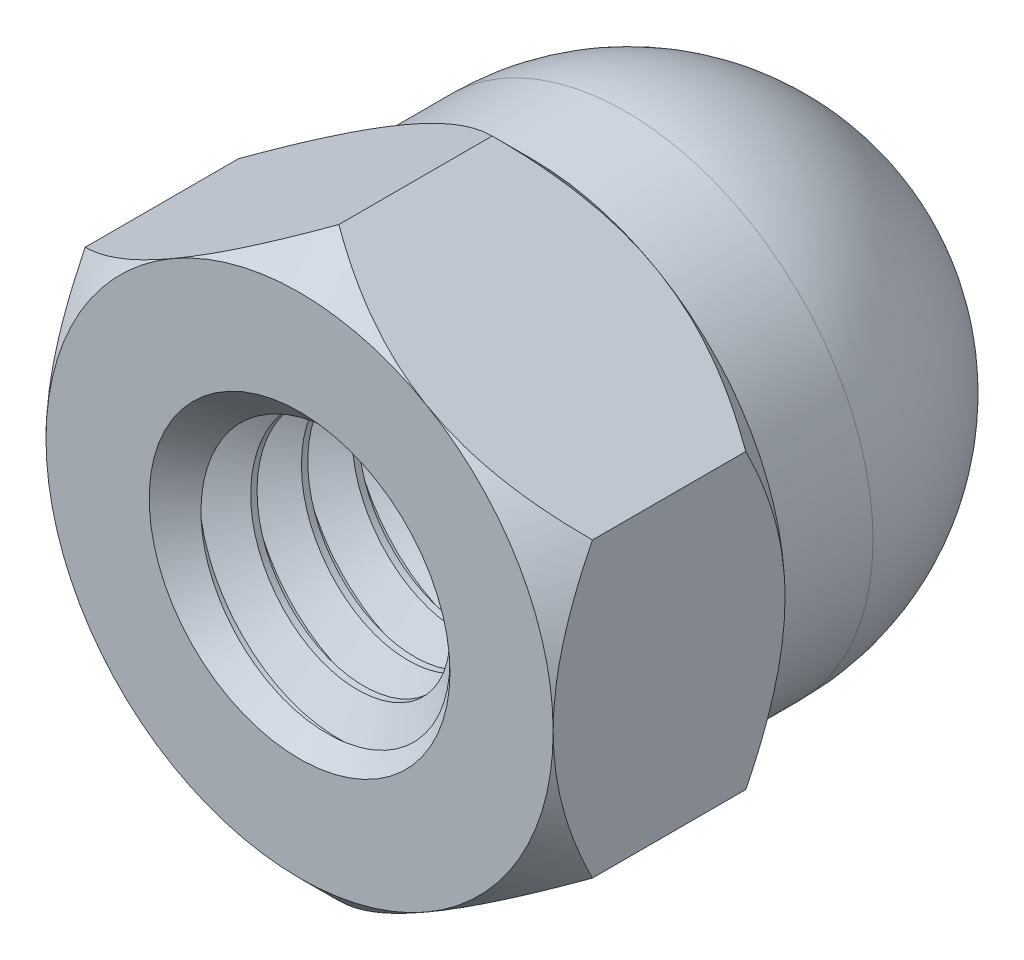
from build123d import *

# Parameters (mm, degrees)
BOSS_EXTRUDE2_DEPTH          = 3.2
SKETCH8_OUTSIDE_W            = 25.694
SKETCH8_OUTSIDE_H            = 26.776
SKETCH8_OUTSIDE_R            = 3.5
CUT_EXTRUDE3_DEPTH           = 7.23083729
CUT_EXTRUDE3_DRAFT           = -45
SKETCH9_OUTSIDE_W            = 25.694
SKETCH9_OUTSIDE_H            = 26.776
SKETCH9_OUTSIDE_R            = 3.5
CUT_EXTRUDE4_DEPTH           = 7.23083729
CUT_EXTRUDE4_DRAFT           = 45
SWEEP1_PITCH                 = 0.7
SKETCH15_R                   = 2.075777223
CUT_EXTRUDE5_OTHER_WAY_DEPTH = 10.622023469
CUT_EXTRUDE5_OTHER_WAY_TAPER = -45


with BuildPart() as part:
    # Sketch7 → Boss-Extrude2 (new body)
    with BuildSketch(Plane.XY.offset(4)):
        Polygon((0, 4.041451884), (-3.5, 2.020725942), (-3.5, -2.020725942), (0, -4.041451884), (3.5, -2.020725942), (3.5, 2.020725942), align=None)
    extrude(amount=-BOSS_EXTRUDE2_DEPTH)


with BuildPart() as cut_extrude3_tool:
    # Sketch8 outside → Cut-Extrude3 (with draft: the straight prism first)
    with BuildSketch(Plane.XY.offset(4)):
        Rectangle(SKETCH8_OUTSIDE_W, SKETCH8_OUTSIDE_H)
        Circle(SKETCH8_OUTSIDE_R, mode=Mode.SUBTRACT)
    extrude(amount=-CUT_EXTRUDE3_DEPTH)
    # Cut-Extrude3: the draft: its side faces are tilted about the plane it starts from
    cut_extrude3_sides = [cut_extrude3_tool.faces().sort_by_distance(p)[0] for p in [
        (0, -13.388, 0.384581355),
        (12.847, 0, 0.384581355),
        (0, 13.388, 0.384581355),
        (-12.847, 0, 0.384581355),
        (-3.5, 0, 0.384581355),
    ]]
    draft(cut_extrude3_sides, Plane.XY.offset(4), CUT_EXTRUDE3_DRAFT)


with BuildPart() as part_1:
    add(part.part)

    # Cut-Extrude3: cut by cut_extrude3_tool
    add(cut_extrude3_tool.part, mode=Mode.SUBTRACT)


with BuildPart() as cut_extrude4_tool:
    # Sketch9 outside → Cut-Extrude4 (with draft: the straight prism first)
    with BuildSketch(Plane.XY.offset(0.8)):
        Rectangle(SKETCH9_OUTSIDE_W, SKETCH9_OUTSIDE_H)
        Circle(SKETCH9_OUTSIDE_R, mode=Mode.SUBTRACT)
    extrude(amount=CUT_EXTRUDE4_DEPTH)
    # Cut-Extrude4: the draft: its side faces are tilted about the plane it starts from
    cut_extrude4_sides = [cut_extrude4_tool.faces().sort_by_distance(p)[0] for p in [
        (0, -13.388, 4.415418645),
        (12.847, 0, 4.415418645),
        (0, 13.388, 4.415418645),
        (-12.847, 0, 4.415418645),
        (-3.5, 0, 4.415418645),
    ]]
    draft(cut_extrude4_sides, Plane.XY.offset(0.8), CUT_EXTRUDE4_DRAFT)


with BuildPart() as part_2:
    add(part_1.part)

    # Cut-Extrude4: cut by cut_extrude4_tool
    add(cut_extrude4_tool.part, mode=Mode.SUBTRACT)

    # Sketch10 → Revolve1 (revolve)
    with BuildSketch(Plane(origin=(0, 0, 0), x_dir=(0, 0, -1), z_dir=(1, 0, 0))):
        with BuildLine():
            Line((0.5, 3.5), (-0.8, 3.5))
            Line((-0.8, 3.5), (-0.8, 0))
            Line((-0.8, 0), (4, 0))
            ThreePointArc((4, 0), (2.974873734, 2.474873734), (0.5, 3.5))
        make_face()
    revolve(axis=Axis((0, 0, -4), (0, 0, 1)))

    # Sketch11 → Cut-Revolve1 (revolve, cut)
    with BuildSketch(Plane(origin=(0, 0, 0), x_dir=(0, 0, -1), z_dir=(1, 0, 0)), mode=Mode.PRIVATE) as cut_revolve1_sk:
        Polygon((-4, 0), (-4, 2), (1.74, 2), (2.275898385, 0), align=None)
    revolve(cut_revolve1_sk.sketch.rotate(Axis((0, 0, -4), (0, 0, 1)), 90), axis=Axis((0, 0, -4), (0, 0, 1)), mode=Mode.SUBTRACT)

    # Sweep1: the profile of Sketch13 screwed along a right-hand helix of 9.2 turns, 6 arcs to a turn; built about Z, then put on its axis
    sweep1_z = Axis((0, 0, 0), (0, 0, 1))
    sweep1_corners = [(2.037888611, 0, -0.634375), (1.545336663, 0, -0.35), (1.545336663, 0, -0.2625), (2.037888611, 0, 0.021875)]
    with BuildLine(mode=Mode.PRIVATE) as sweep1_profile:
        Line(sweep1_corners[0], sweep1_corners[1])
        Line(sweep1_corners[1], sweep1_corners[2])
        Line(sweep1_corners[2], sweep1_corners[3])
        Line(sweep1_corners[3], sweep1_corners[0])
    sweep1_cap = Face(sweep1_profile.wire())
    sweep1_turn_angles = [0, 30, 60, 90, 120, 150, 180, 210, 240, 270, 300, 330, 360]
    sweep1_turn_weights = [1, 0.8660254037844387, 1, 0.8660254037844387, 1, 0.8660254037844387, 1, 0.8660254037844387, 1, 0.8660254037844387, 1, 0.8660254037844387, 1]
    sweep1_turn_rails = [Edge.make_bspline([Vector(p[0], p[1], 0).rotate(sweep1_z, sweep1_turn_angles[k]) / sweep1_turn_weights[k] + Vector(0, 0, p[2] + SWEEP1_PITCH * sweep1_turn_angles[k] / 360) for k in range(13)], [0, 0, 0, 1, 1, 2, 2, 3, 3, 4, 4, 5, 5, 6, 6, 6], 2, sweep1_turn_weights) for p in sweep1_corners]
    sweep1_turn_sides = [Face.make_surface_from_curves(sweep1_turn_rails[p[0]], sweep1_turn_rails[p[1]]) for p in [(0, 1), (1, 2), (2, 3), (3, 0)]]
    sweep1_last_angles = [3240, 3270, 3300, 3306, 3312]
    sweep1_last_weights = [1, 0.8660254037844387, 1, 0.994521895368251, 1]
    sweep1_last_rails = [Edge.make_bspline([Vector(p[0], p[1], 0).rotate(sweep1_z, sweep1_last_angles[k]) / sweep1_last_weights[k] + Vector(0, 0, p[2] + SWEEP1_PITCH * sweep1_last_angles[k] / 360) for k in range(5)], [0, 0, 0, 1, 1, 2, 2, 2], 2, sweep1_last_weights) for p in sweep1_corners]
    sweep1_last_sides = [Face.make_surface_from_curves(sweep1_last_rails[p[0]], sweep1_last_rails[p[1]]) for p in [(0, 1), (1, 2), (2, 3), (3, 0)]]
    sweep1 = Plane(origin=(0, 0, 4), x_dir=(0, 1, 0), z_dir=(0, 0, -1)) * Solid(Shell([*[p.moved(Location((0, 0, SWEEP1_PITCH * i))) for i in range(9) for p in sweep1_turn_sides], *sweep1_last_sides, sweep1_cap, sweep1_cap.rotate(sweep1_z, 3312).moved(Location((0, 0, SWEEP1_PITCH * 3312 / 360)))]))
    add(sweep1)

    # Sketch14 → Cut-Revolve4 (revolve, cut)
    with BuildSketch(Plane(origin=(0, 0, 0), x_dir=(0, 0, -1), z_dir=(1, 0, 0)), mode=Mode.PRIVATE) as cut_revolve4_sk:
        with BuildLine():
            Line((0.5, 3.414022167), (-0.8, 3.414022167))
            Line((-0.8, 3.414022167), (-0.8, 3.5))
            Line((-0.8, 3.5), (0.5, 3.5))
            Line((0.5, 3.5), (4, 3.5))
            Line((4, 3.5), (4.171955666, 3.5))
            Line((4.171955666, 3.5), (4.171955666, 1))
            Line((4.171955666, 1), (4.171955666, 0))
            Line((4.171955666, 0), (4, 0))
            ThreePointArc((4, 0), (2.944664975, 2.419170318), (0.5, 3.414022167))
        make_face()
    revolve(cut_revolve4_sk.sketch.rotate(Axis((0, 0, -4), (0, 0, 1)), 270), axis=Axis((0, 0, -4), (0, 0, 1)), mode=Mode.SUBTRACT)

    # Cut-Extrude5 cone 1 section (through the dimple's axis) → Cut-Extrude5 (revolve, cut)
    with BuildSketch(Plane(origin=(0, 0, 4), x_dir=(0, -1, 0), z_dir=(1, 0, 0))):
        Polygon((0, 0), (2.075777223, 0), (0, 2.075777223), align=None)
    revolve(axis=Axis((0, 0, 4), (0, 0, -1)), mode=Mode.SUBTRACT)

    # Sketch15 → Cut-Extrude5 other way (cut)
    with BuildSketch(Plane.XY.offset(4)):
        Circle(SKETCH15_R)
    extrude(amount=CUT_EXTRUDE5_OTHER_WAY_DEPTH, taper=CUT_EXTRUDE5_OTHER_WAY_TAPER, mode=Mode.SUBTRACT)


solid = part_2.part
